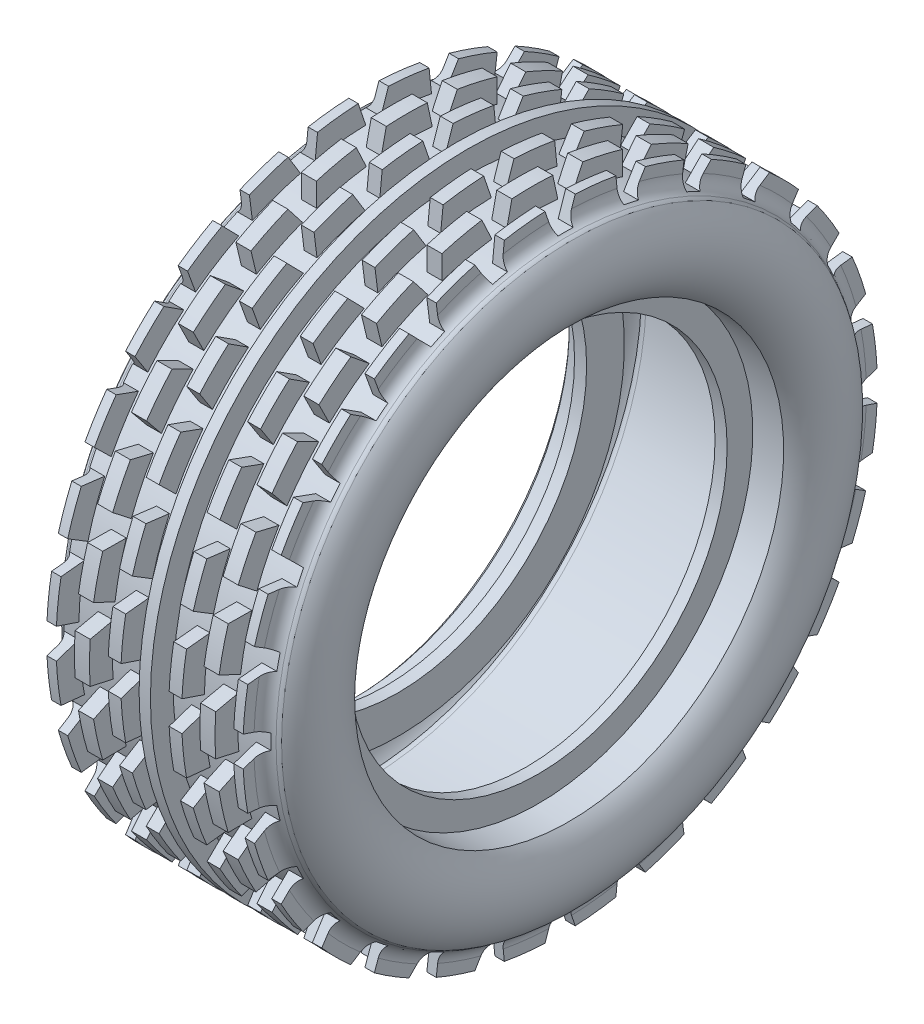
from build123d import *
from build123d.topology import SkipClean

# Parameters (mm, degrees)
CUT_EXTRUDE1_DEPTH = 10
CUT_EXTRUDE2_START = 9
CUT_EXTRUDE2_DEPTH = 4
CUT_EXTRUDE3_START = -4
CUT_EXTRUDE3_DEPTH = 4


with BuildPart() as part:
    # Sketch1 → Revolve3 (revolve)
    with BuildSketch(Plane.XY):
        with BuildLine():
            Line((0, 37.4), (12.99, 37.4))
            ThreePointArc((12.99, 37.4), (13.254410286, 37.364410286), (13.5, 37.260174401))
            ThreePointArc((13.5, 37.260174401), (14.829377395, 33.900490711), (13.830274276, 30.428241913))
            ThreePointArc((13.830274276, 30.428241913), (13.47258407, 30.113501809), (13.009852013, 30))
            Line((13.009852013, 30), (8.5, 30))
            Line((8.5, 30), (8.5, 25))
            Line((8.5, 25), (10.1, 25))
            Line((10.1, 25), (10.1, 28.4))
            Line((10.1, 28.4), (14.184261639, 28.4))
            ThreePointArc((14.184261639, 28.4), (16.430518578, 33.351516393), (14.573852004, 38.461895446))
            ThreePointArc((14.573852004, 38.461895446), (14.354319534, 38.613285388), (14.120434783, 38.74139215))
            ThreePointArc((14.120434783, 38.74139215), (13.296020892, 39.479243969), (12.99, 40.542463035))
            Line((12.99, 40.542463035), (12.99, 42))
            Line((12.99, 42), (11.74, 42))
            Line((11.74, 42), (11.74, 39))
            Line((11.74, 39), (9.31, 39))
            Line((9.31, 39), (9.31, 42))
            Line((9.31, 42), (7.31, 42))
            Line((7.31, 42), (7.31, 39))
            Line((7.31, 39), (4.88, 39))
            Line((4.88, 39), (4.88, 42))
            Line((4.88, 42), (3.18, 42))
            Line((3.18, 42), (3.18, 39))
            Line((3.18, 39), (0.75, 39))
            Line((0.75, 39), (0.75, 42))
            Line((0.75, 42), (0, 42))
            Line((0, 42), (0, 37.4))
        make_face()
    revolve(axis=Axis((-8.310824191, 0, 0), (1, 0, 0)))

    # Sketch3 → Cut-Extrude1 (cut)
    with BuildSketch(Plane.ZY.offset(-11.74)):
        with BuildLine():
            Line((-2, 41.952353927), (-1, 38.987177379))
            ThreePointArc((-1, 38.987177379), (0, 39), (1, 38.987177379))
            Line((1, 38.987177379), (2, 41.952353927))
            ThreePointArc((2, 41.952353927), (0, 42.280522049), (-2, 41.952353927))
        make_face()
        with BuildLine():
            Line((7.385421153, 41.345562693), (7.700535211, 38.232208378))
            ThreePointArc((7.700535211, 38.232208378), (8.678316424, 38.022188575), (9.650391035, 37.78716651))
            Line((9.650391035, 37.78716651), (11.285132802, 40.455478957))
            ThreePointArc((11.285132802, 40.455478957), (9.408301255, 41.220461088), (7.385421153, 41.345562693))
        make_face()
        with BuildLine():
            Line((16.400506451, 38.665532302), (16.014933431, 35.560116805))
            ThreePointArc((16.014933431, 35.560116805), (16.921465826, 35.137785848), (17.816871167, 34.692349327))
            Line((17.816871167, 34.692349327), (20.004381922, 36.929997345))
            ThreePointArc((20.004381922, 36.929997345), (18.344830999, 38.093434085), (16.400506451, 38.665532302))
        make_face()
        with BuildLine():
            Line((24.593201872, 34.046650667), (23.526276017, 31.10489249))
            ThreePointArc((23.526276017, 31.10489249), (24.316102272, 30.491427816), (25.089938982, 29.857912886))
            Line((25.089938982, 29.857912886), (27.720527802, 31.55269146))
            ThreePointArc((27.720527802, 31.55269146), (26.361474315, 33.056243233), (24.593201872, 34.046650667))
        make_face()
        with BuildLine():
            Line((31.55269146, 27.720527802), (29.857912886, 25.089938982))
            ThreePointArc((29.857912886, 25.089938982), (30.491427816, 24.316102272), (31.10489249, 23.526276017))
            Line((31.10489249, 23.526276017), (34.046650667, 24.593201872))
            ThreePointArc((34.046650667, 24.593201872), (33.056243233, 26.361474315), (31.55269146, 27.720527802))
        make_face()
        with BuildLine():
            Line((36.929997345, 20.004381922), (34.692349327, 17.816871167))
            ThreePointArc((34.692349327, 17.816871167), (35.137785848, 16.921465826), (35.560116805, 16.014933431))
            Line((35.560116805, 16.014933431), (38.665532302, 16.400506451))
            ThreePointArc((38.665532302, 16.400506451), (38.093434085, 18.344830999), (36.929997345, 20.004381922))
        make_face()
        with BuildLine():
            Line((40.455478957, 11.285132802), (37.78716651, 9.650391035))
            ThreePointArc((37.78716651, 9.650391035), (38.022188575, 8.678316424), (38.232208378, 7.700535211))
            Line((38.232208378, 7.700535211), (41.345562693, 7.385421153))
            ThreePointArc((41.345562693, 7.385421153), (41.220461088, 9.408301255), (40.455478957, 11.285132802))
        make_face()
        with BuildLine():
            Line((41.952353927, 2), (38.987177379, 1))
            ThreePointArc((38.987177379, 1), (39, 0), (38.987177379, -1))
            Line((38.987177379, -1), (41.952353927, -2))
            ThreePointArc((41.952353927, -2), (42.280522049, 0), (41.952353927, 2))
        make_face()
        with BuildLine():
            Line((41.345562693, -7.385421153), (38.232208378, -7.700535211))
            ThreePointArc((38.232208378, -7.700535211), (38.022188575, -8.678316424), (37.78716651, -9.650391035))
            Line((37.78716651, -9.650391035), (40.455478957, -11.285132802))
            ThreePointArc((40.455478957, -11.285132802), (41.220461088, -9.408301255), (41.345562693, -7.385421153))
        make_face()
        with BuildLine():
            Line((38.665532302, -16.400506451), (35.560116805, -16.014933431))
            ThreePointArc((35.560116805, -16.014933431), (35.137785848, -16.921465826), (34.692349327, -17.816871167))
            Line((34.692349327, -17.816871167), (36.929997345, -20.004381922))
            ThreePointArc((36.929997345, -20.004381922), (38.093434085, -18.344830999), (38.665532302, -16.400506451))
        make_face()
        with BuildLine():
            Line((34.046650667, -24.593201872), (31.10489249, -23.526276017))
            ThreePointArc((31.10489249, -23.526276017), (30.491427816, -24.316102272), (29.857912886, -25.089938982))
            Line((29.857912886, -25.089938982), (31.55269146, -27.720527802))
            ThreePointArc((31.55269146, -27.720527802), (33.056243233, -26.361474315), (34.046650667, -24.593201872))
        make_face()
        with BuildLine():
            Line((27.720527802, -31.55269146), (25.089938982, -29.857912886))
            ThreePointArc((25.089938982, -29.857912886), (24.316102272, -30.491427816), (23.526276017, -31.10489249))
            Line((23.526276017, -31.10489249), (24.593201872, -34.046650667))
            ThreePointArc((24.593201872, -34.046650667), (26.361474315, -33.056243233), (27.720527802, -31.55269146))
        make_face()
        with BuildLine():
            Line((20.004381922, -36.929997345), (17.816871167, -34.692349327))
            ThreePointArc((17.816871167, -34.692349327), (16.921465826, -35.137785848), (16.014933431, -35.560116805))
            Line((16.014933431, -35.560116805), (16.400506451, -38.665532302))
            ThreePointArc((16.400506451, -38.665532302), (18.344830999, -38.093434085), (20.004381922, -36.929997345))
        make_face()
        with BuildLine():
            Line((11.285132802, -40.455478957), (9.650391035, -37.78716651))
            ThreePointArc((9.650391035, -37.78716651), (8.678316424, -38.022188575), (7.700535211, -38.232208378))
            Line((7.700535211, -38.232208378), (7.385421153, -41.345562693))
            ThreePointArc((7.385421153, -41.345562693), (9.408301255, -41.220461088), (11.285132802, -40.455478957))
        make_face()
        with BuildLine():
            Line((2, -41.952353927), (1, -38.987177379))
            ThreePointArc((1, -38.987177379), (0, -39), (-1, -38.987177379))
            Line((-1, -38.987177379), (-2, -41.952353927))
            ThreePointArc((-2, -41.952353927), (0, -42.280522049), (2, -41.952353927))
        make_face()
        with BuildLine():
            Line((-7.385421153, -41.345562693), (-7.700535211, -38.232208378))
            ThreePointArc((-7.700535211, -38.232208378), (-8.678316424, -38.022188575), (-9.650391035, -37.78716651))
            Line((-9.650391035, -37.78716651), (-11.285132802, -40.455478957))
            ThreePointArc((-11.285132802, -40.455478957), (-9.408301255, -41.220461088), (-7.385421153, -41.345562693))
        make_face()
        with BuildLine():
            Line((-16.400506451, -38.665532302), (-16.014933431, -35.560116805))
            ThreePointArc((-16.014933431, -35.560116805), (-16.921465826, -35.137785848), (-17.816871167, -34.692349327))
            Line((-17.816871167, -34.692349327), (-20.004381922, -36.929997345))
            ThreePointArc((-20.004381922, -36.929997345), (-18.344830999, -38.093434085), (-16.400506451, -38.665532302))
        make_face()
        with BuildLine():
            Line((-24.593201872, -34.046650667), (-23.526276017, -31.10489249))
            ThreePointArc((-23.526276017, -31.10489249), (-24.316102272, -30.491427816), (-25.089938982, -29.857912886))
            Line((-25.089938982, -29.857912886), (-27.720527802, -31.55269146))
            ThreePointArc((-27.720527802, -31.55269146), (-26.361474315, -33.056243233), (-24.593201872, -34.046650667))
        make_face()
        with BuildLine():
            Line((-31.55269146, -27.720527802), (-29.857912886, -25.089938982))
            ThreePointArc((-29.857912886, -25.089938982), (-30.491427816, -24.316102272), (-31.10489249, -23.526276017))
            Line((-31.10489249, -23.526276017), (-34.046650667, -24.593201872))
            ThreePointArc((-34.046650667, -24.593201872), (-33.056243233, -26.361474315), (-31.55269146, -27.720527802))
        make_face()
        with BuildLine():
            Line((-36.929997345, -20.004381922), (-34.692349327, -17.816871167))
            ThreePointArc((-34.692349327, -17.816871167), (-35.137785848, -16.921465826), (-35.560116805, -16.014933431))
            Line((-35.560116805, -16.014933431), (-38.665532302, -16.400506451))
            ThreePointArc((-38.665532302, -16.400506451), (-38.093434085, -18.344830999), (-36.929997345, -20.004381922))
        make_face()
        with BuildLine():
            Line((-40.455478957, -11.285132802), (-37.78716651, -9.650391035))
            ThreePointArc((-37.78716651, -9.650391035), (-38.022188575, -8.678316424), (-38.232208378, -7.700535211))
            Line((-38.232208378, -7.700535211), (-41.345562693, -7.385421153))
            ThreePointArc((-41.345562693, -7.385421153), (-41.220461088, -9.408301255), (-40.455478957, -11.285132802))
        make_face()
        with BuildLine():
            Line((-41.952353927, -2), (-38.987177379, -1))
            ThreePointArc((-38.987177379, -1), (-39, 0), (-38.987177379, 1))
            Line((-38.987177379, 1), (-41.952353927, 2))
            ThreePointArc((-41.952353927, 2), (-42.280522049, 0), (-41.952353927, -2))
        make_face()
        with BuildLine():
            Line((-41.345562693, 7.385421153), (-38.232208378, 7.700535211))
            ThreePointArc((-38.232208378, 7.700535211), (-38.022188575, 8.678316424), (-37.78716651, 9.650391035))
            Line((-37.78716651, 9.650391035), (-40.455478957, 11.285132802))
            ThreePointArc((-40.455478957, 11.285132802), (-41.220461088, 9.408301255), (-41.345562693, 7.385421153))
        make_face()
        with BuildLine():
            Line((-38.665532302, 16.400506451), (-35.560116805, 16.014933431))
            ThreePointArc((-35.560116805, 16.014933431), (-35.137785848, 16.921465826), (-34.692349327, 17.816871167))
            Line((-34.692349327, 17.816871167), (-36.929997345, 20.004381922))
            ThreePointArc((-36.929997345, 20.004381922), (-38.093434085, 18.344830999), (-38.665532302, 16.400506451))
        make_face()
        with BuildLine():
            Line((-34.046650667, 24.593201872), (-31.10489249, 23.526276017))
            ThreePointArc((-31.10489249, 23.526276017), (-30.491427816, 24.316102272), (-29.857912886, 25.089938982))
            Line((-29.857912886, 25.089938982), (-31.55269146, 27.720527802))
            ThreePointArc((-31.55269146, 27.720527802), (-33.056243233, 26.361474315), (-34.046650667, 24.593201872))
        make_face()
        with BuildLine():
            Line((-27.720527802, 31.55269146), (-25.089938982, 29.857912886))
            ThreePointArc((-25.089938982, 29.857912886), (-24.316102272, 30.491427816), (-23.526276017, 31.10489249))
            Line((-23.526276017, 31.10489249), (-24.593201872, 34.046650667))
            ThreePointArc((-24.593201872, 34.046650667), (-26.361474315, 33.056243233), (-27.720527802, 31.55269146))
        make_face()
        with BuildLine():
            Line((-20.004381922, 36.929997345), (-17.816871167, 34.692349327))
            ThreePointArc((-17.816871167, 34.692349327), (-16.921465826, 35.137785848), (-16.014933431, 35.560116805))
            Line((-16.014933431, 35.560116805), (-16.400506451, 38.665532302))
            ThreePointArc((-16.400506451, 38.665532302), (-18.344830999, 38.093434085), (-20.004381922, 36.929997345))
        make_face()
        with BuildLine():
            Line((-11.285132802, 40.455478957), (-9.650391035, 37.78716651))
            ThreePointArc((-9.650391035, 37.78716651), (-8.678316424, 38.022188575), (-7.700535211, 38.232208378))
            Line((-7.700535211, 38.232208378), (-7.385421153, 41.345562693))
            ThreePointArc((-7.385421153, 41.345562693), (-9.408301255, 41.220461088), (-11.285132802, 40.455478957))
        make_face()
    extrude(amount=-CUT_EXTRUDE1_DEPTH, mode=Mode.SUBTRACT)

    # Sketch3<2> → Cut-Extrude2 (cut)
    with SkipClean():  # the faces are left unmerged after this step: merging them gives an invalid solid
        with BuildSketch(Plane.ZY.offset(-11.74).offset(CUT_EXTRUDE2_START)):
            with BuildLine():
                Line((-2, 41.952353927), (-1, 38.987177379))
                ThreePointArc((-1, 38.987177379), (0, 39), (1, 38.987177379))
                Line((1, 38.987177379), (2, 41.952353927))
                ThreePointArc((2, 41.952353927), (0, 42.280522049), (-2, 41.952353927))
            make_face()
            with BuildLine():
                Line((7.385421153, 41.345562693), (7.700535211, 38.232208378))
                ThreePointArc((7.700535211, 38.232208378), (8.678316424, 38.022188575), (9.650391035, 37.78716651))
                Line((9.650391035, 37.78716651), (11.285132802, 40.455478957))
                ThreePointArc((11.285132802, 40.455478957), (9.408301255, 41.220461088), (7.385421153, 41.345562693))
            make_face()
            with BuildLine():
                Line((16.400506451, 38.665532302), (16.014933431, 35.560116805))
                ThreePointArc((16.014933431, 35.560116805), (16.921465826, 35.137785848), (17.816871167, 34.692349327))
                Line((17.816871167, 34.692349327), (20.004381922, 36.929997345))
                ThreePointArc((20.004381922, 36.929997345), (18.344830999, 38.093434085), (16.400506451, 38.665532302))
            make_face()
            with BuildLine():
                Line((24.593201872, 34.046650667), (23.526276017, 31.10489249))
                ThreePointArc((23.526276017, 31.10489249), (24.316102272, 30.491427816), (25.089938982, 29.857912886))
                Line((25.089938982, 29.857912886), (27.720527802, 31.55269146))
                ThreePointArc((27.720527802, 31.55269146), (26.361474315, 33.056243233), (24.593201872, 34.046650667))
            make_face()
            with BuildLine():
                Line((31.55269146, 27.720527802), (29.857912886, 25.089938982))
                ThreePointArc((29.857912886, 25.089938982), (30.491427816, 24.316102272), (31.10489249, 23.526276017))
                Line((31.10489249, 23.526276017), (34.046650667, 24.593201872))
                ThreePointArc((34.046650667, 24.593201872), (33.056243233, 26.361474315), (31.55269146, 27.720527802))
            make_face()
            with BuildLine():
                Line((36.929997345, 20.004381922), (34.692349327, 17.816871167))
                ThreePointArc((34.692349327, 17.816871167), (35.137785848, 16.921465826), (35.560116805, 16.014933431))
                Line((35.560116805, 16.014933431), (38.665532302, 16.400506451))
                ThreePointArc((38.665532302, 16.400506451), (38.093434085, 18.344830999), (36.929997345, 20.004381922))
            make_face()
            with BuildLine():
                Line((40.455478957, 11.285132802), (37.78716651, 9.650391035))
                ThreePointArc((37.78716651, 9.650391035), (38.022188575, 8.678316424), (38.232208378, 7.700535211))
                Line((38.232208378, 7.700535211), (41.345562693, 7.385421153))
                ThreePointArc((41.345562693, 7.385421153), (41.220461088, 9.408301255), (40.455478957, 11.285132802))
            make_face()
            with BuildLine():
                Line((41.952353927, 2), (38.987177379, 1))
                ThreePointArc((38.987177379, 1), (39, 0), (38.987177379, -1))
                Line((38.987177379, -1), (41.952353927, -2))
                ThreePointArc((41.952353927, -2), (42.280522049, 0), (41.952353927, 2))
            make_face()
            with BuildLine():
                Line((41.345562693, -7.385421153), (38.232208378, -7.700535211))
                ThreePointArc((38.232208378, -7.700535211), (38.022188575, -8.678316424), (37.78716651, -9.650391035))
                Line((37.78716651, -9.650391035), (40.455478957, -11.285132802))
                ThreePointArc((40.455478957, -11.285132802), (41.220461088, -9.408301255), (41.345562693, -7.385421153))
            make_face()
            with BuildLine():
                Line((38.665532302, -16.400506451), (35.560116805, -16.014933431))
                ThreePointArc((35.560116805, -16.014933431), (35.137785848, -16.921465826), (34.692349327, -17.816871167))
                Line((34.692349327, -17.816871167), (36.929997345, -20.004381922))
                ThreePointArc((36.929997345, -20.004381922), (38.093434085, -18.344830999), (38.665532302, -16.400506451))
            make_face()
            with BuildLine():
                Line((34.046650667, -24.593201872), (31.10489249, -23.526276017))
                ThreePointArc((31.10489249, -23.526276017), (30.491427816, -24.316102272), (29.857912886, -25.089938982))
                Line((29.857912886, -25.089938982), (31.55269146, -27.720527802))
                ThreePointArc((31.55269146, -27.720527802), (33.056243233, -26.361474315), (34.046650667, -24.593201872))
            make_face()
            with BuildLine():
                Line((27.720527802, -31.55269146), (25.089938982, -29.857912886))
                ThreePointArc((25.089938982, -29.857912886), (24.316102272, -30.491427816), (23.526276017, -31.10489249))
                Line((23.526276017, -31.10489249), (24.593201872, -34.046650667))
                ThreePointArc((24.593201872, -34.046650667), (26.361474315, -33.056243233), (27.720527802, -31.55269146))
            make_face()
            with BuildLine():
                Line((20.004381922, -36.929997345), (17.816871167, -34.692349327))
                ThreePointArc((17.816871167, -34.692349327), (16.921465826, -35.137785848), (16.014933431, -35.560116805))
                Line((16.014933431, -35.560116805), (16.400506451, -38.665532302))
                ThreePointArc((16.400506451, -38.665532302), (18.344830999, -38.093434085), (20.004381922, -36.929997345))
            make_face()
            with BuildLine():
                Line((11.285132802, -40.455478957), (9.650391035, -37.78716651))
                ThreePointArc((9.650391035, -37.78716651), (8.678316424, -38.022188575), (7.700535211, -38.232208378))
                Line((7.700535211, -38.232208378), (7.385421153, -41.345562693))
                ThreePointArc((7.385421153, -41.345562693), (9.408301255, -41.220461088), (11.285132802, -40.455478957))
            make_face()
            with BuildLine():
                Line((2, -41.952353927), (1, -38.987177379))
                ThreePointArc((1, -38.987177379), (0, -39), (-1, -38.987177379))
                Line((-1, -38.987177379), (-2, -41.952353927))
                ThreePointArc((-2, -41.952353927), (0, -42.280522049), (2, -41.952353927))
            make_face()
            with BuildLine():
                Line((-7.385421153, -41.345562693), (-7.700535211, -38.232208378))
                ThreePointArc((-7.700535211, -38.232208378), (-8.678316424, -38.022188575), (-9.650391035, -37.78716651))
                Line((-9.650391035, -37.78716651), (-11.285132802, -40.455478957))
                ThreePointArc((-11.285132802, -40.455478957), (-9.408301255, -41.220461088), (-7.385421153, -41.345562693))
            make_face()
            with BuildLine():
                Line((-16.400506451, -38.665532302), (-16.014933431, -35.560116805))
                ThreePointArc((-16.014933431, -35.560116805), (-16.921465826, -35.137785848), (-17.816871167, -34.692349327))
                Line((-17.816871167, -34.692349327), (-20.004381922, -36.929997345))
                ThreePointArc((-20.004381922, -36.929997345), (-18.344830999, -38.093434085), (-16.400506451, -38.665532302))
            make_face()
            with BuildLine():
                Line((-24.593201872, -34.046650667), (-23.526276017, -31.10489249))
                ThreePointArc((-23.526276017, -31.10489249), (-24.316102272, -30.491427816), (-25.089938982, -29.857912886))
                Line((-25.089938982, -29.857912886), (-27.720527802, -31.55269146))
                ThreePointArc((-27.720527802, -31.55269146), (-26.361474315, -33.056243233), (-24.593201872, -34.046650667))
            make_face()
            with BuildLine():
                Line((-31.55269146, -27.720527802), (-29.857912886, -25.089938982))
                ThreePointArc((-29.857912886, -25.089938982), (-30.491427816, -24.316102272), (-31.10489249, -23.526276017))
                Line((-31.10489249, -23.526276017), (-34.046650667, -24.593201872))
                ThreePointArc((-34.046650667, -24.593201872), (-33.056243233, -26.361474315), (-31.55269146, -27.720527802))
            make_face()
            with BuildLine():
                Line((-36.929997345, -20.004381922), (-34.692349327, -17.816871167))
                ThreePointArc((-34.692349327, -17.816871167), (-35.137785848, -16.921465826), (-35.560116805, -16.014933431))
                Line((-35.560116805, -16.014933431), (-38.665532302, -16.400506451))
                ThreePointArc((-38.665532302, -16.400506451), (-38.093434085, -18.344830999), (-36.929997345, -20.004381922))
            make_face()
            with BuildLine():
                Line((-40.455478957, -11.285132802), (-37.78716651, -9.650391035))
                ThreePointArc((-37.78716651, -9.650391035), (-38.022188575, -8.678316424), (-38.232208378, -7.700535211))
                Line((-38.232208378, -7.700535211), (-41.345562693, -7.385421153))
                ThreePointArc((-41.345562693, -7.385421153), (-41.220461088, -9.408301255), (-40.455478957, -11.285132802))
            make_face()
            with BuildLine():
                Line((-41.952353927, -2), (-38.987177379, -1))
                ThreePointArc((-38.987177379, -1), (-39, 0), (-38.987177379, 1))
                Line((-38.987177379, 1), (-41.952353927, 2))
                ThreePointArc((-41.952353927, 2), (-42.280522049, 0), (-41.952353927, -2))
            make_face()
            with BuildLine():
                Line((-41.345562693, 7.385421153), (-38.232208378, 7.700535211))
                ThreePointArc((-38.232208378, 7.700535211), (-38.022188575, 8.678316424), (-37.78716651, 9.650391035))
                Line((-37.78716651, 9.650391035), (-40.455478957, 11.285132802))
                ThreePointArc((-40.455478957, 11.285132802), (-41.220461088, 9.408301255), (-41.345562693, 7.385421153))
            make_face()
            with BuildLine():
                Line((-38.665532302, 16.400506451), (-35.560116805, 16.014933431))
                ThreePointArc((-35.560116805, 16.014933431), (-35.137785848, 16.921465826), (-34.692349327, 17.816871167))
                Line((-34.692349327, 17.816871167), (-36.929997345, 20.004381922))
                ThreePointArc((-36.929997345, 20.004381922), (-38.093434085, 18.344830999), (-38.665532302, 16.400506451))
            make_face()
            with BuildLine():
                Line((-34.046650667, 24.593201872), (-31.10489249, 23.526276017))
                ThreePointArc((-31.10489249, 23.526276017), (-30.491427816, 24.316102272), (-29.857912886, 25.089938982))
                Line((-29.857912886, 25.089938982), (-31.55269146, 27.720527802))
                ThreePointArc((-31.55269146, 27.720527802), (-33.056243233, 26.361474315), (-34.046650667, 24.593201872))
            make_face()
            with BuildLine():
                Line((-27.720527802, 31.55269146), (-25.089938982, 29.857912886))
                ThreePointArc((-25.089938982, 29.857912886), (-24.316102272, 30.491427816), (-23.526276017, 31.10489249))
                Line((-23.526276017, 31.10489249), (-24.593201872, 34.046650667))
                ThreePointArc((-24.593201872, 34.046650667), (-26.361474315, 33.056243233), (-27.720527802, 31.55269146))
            make_face()
            with BuildLine():
                Line((-20.004381922, 36.929997345), (-17.816871167, 34.692349327))
                ThreePointArc((-17.816871167, 34.692349327), (-16.921465826, 35.137785848), (-16.014933431, 35.560116805))
                Line((-16.014933431, 35.560116805), (-16.400506451, 38.665532302))
                ThreePointArc((-16.400506451, 38.665532302), (-18.344830999, 38.093434085), (-20.004381922, 36.929997345))
            make_face()
            with BuildLine():
                Line((-11.285132802, 40.455478957), (-9.650391035, 37.78716651))
                ThreePointArc((-9.650391035, 37.78716651), (-8.678316424, 38.022188575), (-7.700535211, 38.232208378))
                Line((-7.700535211, 38.232208378), (-7.385421153, 41.345562693))
                ThreePointArc((-7.385421153, 41.345562693), (-9.408301255, 41.220461088), (-11.285132802, 40.455478957))
            make_face()
        extrude(amount=-CUT_EXTRUDE2_DEPTH, mode=Mode.SUBTRACT)

    # Sketch4 → Cut-Extrude3 (cut)
    with SkipClean():  # the faces are left unmerged after this step: merging them gives an invalid solid
        with BuildSketch(Plane(origin=(9.31, 0, 0), x_dir=(0, 0, -1), z_dir=(1, 0, 0)).offset(CUT_EXTRUDE3_START)):
            with BuildLine():
                Line((-5.3588911, 38.630069715), (-6.684597749, 41.464637379))
                ThreePointArc((-6.684597749, 41.464637379), (-4.733916501, 42.014671001), (-2.709748909, 41.912495283))
                Line((-2.709748909, 41.912495283), (-3.37146668, 38.853998667))
                ThreePointArc((-3.37146668, 38.853998667), (-4.366614568, 38.754776186), (-5.3588911, 38.630069715))
            make_face()
            with BuildLine():
                Line((3.37146668, 38.853998667), (2.709748909, 41.912495283))
                ThreePointArc((2.709748909, 41.912495283), (4.733916501, 42.014671001), (6.684597749, 41.464637379))
                Line((6.684597749, 41.464637379), (5.3588911, 38.630069715))
                ThreePointArc((5.3588911, 38.630069715), (4.366614568, 38.754776186), (3.37146668, 38.853998667))
            make_face()
            with BuildLine():
                Line((11.932765043, 37.129625886), (11.968217441, 40.258685663))
                ThreePointArc((11.968217441, 40.258685663), (13.964371161, 39.907879959), (15.743750762, 38.937569415))
                Line((15.743750762, 38.937569415), (13.820531703, 36.469067762))
                ThreePointArc((13.820531703, 36.469067762), (12.880883416, 36.811449882), (11.932765043, 37.129625886))
            make_face()
            with BuildLine():
                Line((19.895704739, 33.543418623), (20.626549576, 36.586137437))
                ThreePointArc((20.626549576, 36.586137437), (22.494593942, 35.799941175), (24.013446373, 34.458009131))
                Line((24.013446373, 34.458009131), (21.589153138, 32.47935447))
                ThreePointArc((21.589153138, 32.47935447), (20.749250984, 33.02224377), (19.895704739, 33.543418623))
            make_face()
            with BuildLine():
                Line((26.860990723, 28.275204285), (28.250580386, 31.079007511))
                ThreePointArc((28.250580386, 31.079007511), (29.896843853, 29.896843853), (31.079007511, 28.250580386))
                Line((31.079007511, 28.250580386), (28.275204285, 26.860990723))
                ThreePointArc((28.275204285, 26.860990723), (27.577164466, 27.577164466), (26.860990723, 28.275204285))
            make_face()
            with BuildLine():
                Line((32.47935447, 21.589153138), (34.458009131, 24.013446373))
                ThreePointArc((34.458009131, 24.013446373), (35.799941175, 22.494593942), (36.586137437, 20.626549576))
                Line((36.586137437, 20.626549576), (33.543418623, 19.895704739))
                ThreePointArc((33.543418623, 19.895704739), (33.02224377, 20.749250984), (32.47935447, 21.589153138))
            make_face()
            with BuildLine():
                Line((36.469067762, 13.820531703), (38.937569415, 15.743750762))
                ThreePointArc((38.937569415, 15.743750762), (39.907879959, 13.964371161), (40.258685663, 11.968217441))
                Line((40.258685663, 11.968217441), (37.129625886, 11.932765043))
                ThreePointArc((37.129625886, 11.932765043), (36.811449882, 12.880883416), (36.469067762, 13.820531703))
            make_face()
            with BuildLine():
                Line((38.630069715, 5.3588911), (41.464637379, 6.684597749))
                ThreePointArc((41.464637379, 6.684597749), (42.014671001, 4.733916501), (41.912495283, 2.709748909))
                Line((41.912495283, 2.709748909), (38.853998667, 3.37146668))
                ThreePointArc((38.853998667, 3.37146668), (38.754776186, 4.366614568), (38.630069715, 5.3588911))
            make_face()
            with BuildLine():
                Line((38.853998667, -3.37146668), (41.912495283, -2.709748909))
                ThreePointArc((41.912495283, -2.709748909), (42.014671001, -4.733916501), (41.464637379, -6.684597749))
                Line((41.464637379, -6.684597749), (38.630069715, -5.3588911))
                ThreePointArc((38.630069715, -5.3588911), (38.754776186, -4.366614568), (38.853998667, -3.37146668))
            make_face()
            with BuildLine():
                Line((37.129625886, -11.932765043), (40.258685663, -11.968217441))
                ThreePointArc((40.258685663, -11.968217441), (39.907879959, -13.964371161), (38.937569415, -15.743750762))
                Line((38.937569415, -15.743750762), (36.469067762, -13.820531703))
                ThreePointArc((36.469067762, -13.820531703), (36.811449882, -12.880883416), (37.129625886, -11.932765043))
            make_face()
            with BuildLine():
                Line((33.543418623, -19.895704739), (36.586137437, -20.626549576))
                ThreePointArc((36.586137437, -20.626549576), (35.799941175, -22.494593942), (34.458009131, -24.013446373))
                Line((34.458009131, -24.013446373), (32.47935447, -21.589153138))
                ThreePointArc((32.47935447, -21.589153138), (33.02224377, -20.749250984), (33.543418623, -19.895704739))
            make_face()
            with BuildLine():
                Line((28.275204285, -26.860990723), (31.079007511, -28.250580386))
                ThreePointArc((31.079007511, -28.250580386), (29.896843853, -29.896843853), (28.250580386, -31.079007511))
                Line((28.250580386, -31.079007511), (26.860990723, -28.275204285))
                ThreePointArc((26.860990723, -28.275204285), (27.577164466, -27.577164466), (28.275204285, -26.860990723))
            make_face()
            with BuildLine():
                Line((21.589153138, -32.47935447), (24.013446373, -34.458009131))
                ThreePointArc((24.013446373, -34.458009131), (22.494593942, -35.799941175), (20.626549576, -36.586137437))
                Line((20.626549576, -36.586137437), (19.895704739, -33.543418623))
                ThreePointArc((19.895704739, -33.543418623), (20.749250984, -33.02224377), (21.589153138, -32.47935447))
            make_face()
            with BuildLine():
                Line((13.820531703, -36.469067762), (15.743750762, -38.937569415))
                ThreePointArc((15.743750762, -38.937569415), (13.964371161, -39.907879959), (11.968217441, -40.258685663))
                Line((11.968217441, -40.258685663), (11.932765043, -37.129625886))
                ThreePointArc((11.932765043, -37.129625886), (12.880883416, -36.811449882), (13.820531703, -36.469067762))
            make_face()
            with BuildLine():
                Line((5.3588911, -38.630069715), (6.684597749, -41.464637379))
                ThreePointArc((6.684597749, -41.464637379), (4.733916501, -42.014671001), (2.709748909, -41.912495283))
                Line((2.709748909, -41.912495283), (3.37146668, -38.853998667))
                ThreePointArc((3.37146668, -38.853998667), (4.366614568, -38.754776186), (5.3588911, -38.630069715))
            make_face()
            with BuildLine():
                Line((-3.37146668, -38.853998667), (-2.709748909, -41.912495283))
                ThreePointArc((-2.709748909, -41.912495283), (-4.733916501, -42.014671001), (-6.684597749, -41.464637379))
                Line((-6.684597749, -41.464637379), (-5.3588911, -38.630069715))
                ThreePointArc((-5.3588911, -38.630069715), (-4.366614568, -38.754776186), (-3.37146668, -38.853998667))
            make_face()
            with BuildLine():
                Line((-11.932765043, -37.129625886), (-11.968217441, -40.258685663))
                ThreePointArc((-11.968217441, -40.258685663), (-13.964371161, -39.907879959), (-15.743750762, -38.937569415))
                Line((-15.743750762, -38.937569415), (-13.820531703, -36.469067762))
                ThreePointArc((-13.820531703, -36.469067762), (-12.880883416, -36.811449882), (-11.932765043, -37.129625886))
            make_face()
            with BuildLine():
                Line((-19.895704739, -33.543418623), (-20.626549576, -36.586137437))
                ThreePointArc((-20.626549576, -36.586137437), (-22.494593942, -35.799941175), (-24.013446373, -34.458009131))
                Line((-24.013446373, -34.458009131), (-21.589153138, -32.47935447))
                ThreePointArc((-21.589153138, -32.47935447), (-20.749250984, -33.02224377), (-19.895704739, -33.543418623))
            make_face()
            with BuildLine():
                Line((-26.860990723, -28.275204285), (-28.250580386, -31.079007511))
                ThreePointArc((-28.250580386, -31.079007511), (-29.896843853, -29.896843853), (-31.079007511, -28.250580386))
                Line((-31.079007511, -28.250580386), (-28.275204285, -26.860990723))
                ThreePointArc((-28.275204285, -26.860990723), (-27.577164466, -27.577164466), (-26.860990723, -28.275204285))
            make_face()
            with BuildLine():
                Line((-32.47935447, -21.589153138), (-34.458009131, -24.013446373))
                ThreePointArc((-34.458009131, -24.013446373), (-35.799941175, -22.494593942), (-36.586137437, -20.626549576))
                Line((-36.586137437, -20.626549576), (-33.543418623, -19.895704739))
                ThreePointArc((-33.543418623, -19.895704739), (-33.02224377, -20.749250984), (-32.47935447, -21.589153138))
            make_face()
            with BuildLine():
                Line((-36.469067762, -13.820531703), (-38.937569415, -15.743750762))
                ThreePointArc((-38.937569415, -15.743750762), (-39.907879959, -13.964371161), (-40.258685663, -11.968217441))
                Line((-40.258685663, -11.968217441), (-37.129625886, -11.932765043))
                ThreePointArc((-37.129625886, -11.932765043), (-36.811449882, -12.880883416), (-36.469067762, -13.820531703))
            make_face()
            with BuildLine():
                Line((-38.630069715, -5.3588911), (-41.464637379, -6.684597749))
                ThreePointArc((-41.464637379, -6.684597749), (-42.014671001, -4.733916501), (-41.912495283, -2.709748909))
                Line((-41.912495283, -2.709748909), (-38.853998667, -3.37146668))
                ThreePointArc((-38.853998667, -3.37146668), (-38.754776186, -4.366614568), (-38.630069715, -5.3588911))
            make_face()
            with BuildLine():
                Line((-38.853998667, 3.37146668), (-41.912495283, 2.709748909))
                ThreePointArc((-41.912495283, 2.709748909), (-42.014671001, 4.733916501), (-41.464637379, 6.684597749))
                Line((-41.464637379, 6.684597749), (-38.630069715, 5.3588911))
                ThreePointArc((-38.630069715, 5.3588911), (-38.754776186, 4.366614568), (-38.853998667, 3.37146668))
            make_face()
            with BuildLine():
                Line((-37.129625886, 11.932765043), (-40.258685663, 11.968217441))
                ThreePointArc((-40.258685663, 11.968217441), (-39.907879959, 13.964371161), (-38.937569415, 15.743750762))
                Line((-38.937569415, 15.743750762), (-36.469067762, 13.820531703))
                ThreePointArc((-36.469067762, 13.820531703), (-36.811449882, 12.880883416), (-37.129625886, 11.932765043))
            make_face()
            with BuildLine():
                Line((-33.543418623, 19.895704739), (-36.586137437, 20.626549576))
                ThreePointArc((-36.586137437, 20.626549576), (-35.799941175, 22.494593942), (-34.458009131, 24.013446373))
                Line((-34.458009131, 24.013446373), (-32.47935447, 21.589153138))
                ThreePointArc((-32.47935447, 21.589153138), (-33.02224377, 20.749250984), (-33.543418623, 19.895704739))
            make_face()
            with BuildLine():
                Line((-28.275204285, 26.860990723), (-31.079007511, 28.250580386))
                ThreePointArc((-31.079007511, 28.250580386), (-29.896843853, 29.896843853), (-28.250580386, 31.079007511))
                Line((-28.250580386, 31.079007511), (-26.860990723, 28.275204285))
                ThreePointArc((-26.860990723, 28.275204285), (-27.577164466, 27.577164466), (-28.275204285, 26.860990723))
            make_face()
            with BuildLine():
                Line((-21.589153138, 32.47935447), (-24.013446373, 34.458009131))
                ThreePointArc((-24.013446373, 34.458009131), (-22.494593942, 35.799941175), (-20.626549576, 36.586137437))
                Line((-20.626549576, 36.586137437), (-19.895704739, 33.543418623))
                ThreePointArc((-19.895704739, 33.543418623), (-20.749250984, 33.02224377), (-21.589153138, 32.47935447))
            make_face()
            with BuildLine():
                Line((-13.820531703, 36.469067762), (-15.743750762, 38.937569415))
                ThreePointArc((-15.743750762, 38.937569415), (-13.964371161, 39.907879959), (-11.968217441, 40.258685663))
                Line((-11.968217441, 40.258685663), (-11.932765043, 37.129625886))
                ThreePointArc((-11.932765043, 37.129625886), (-12.880883416, 36.811449882), (-13.820531703, 36.469067762))
            make_face()
        extrude(amount=CUT_EXTRUDE3_DEPTH, mode=Mode.SUBTRACT)

    # Mirror1: part across plane


with BuildPart() as part_1:
    with SkipClean():  # the faces are left unmerged after this step: merging them gives an invalid solid
        add(part.part)
        add(part.part.mirror(Plane(origin=(0, 0, 0), x_dir=(0, 0, 1), z_dir=(1, 0, 0))))


solid = part_1.part
